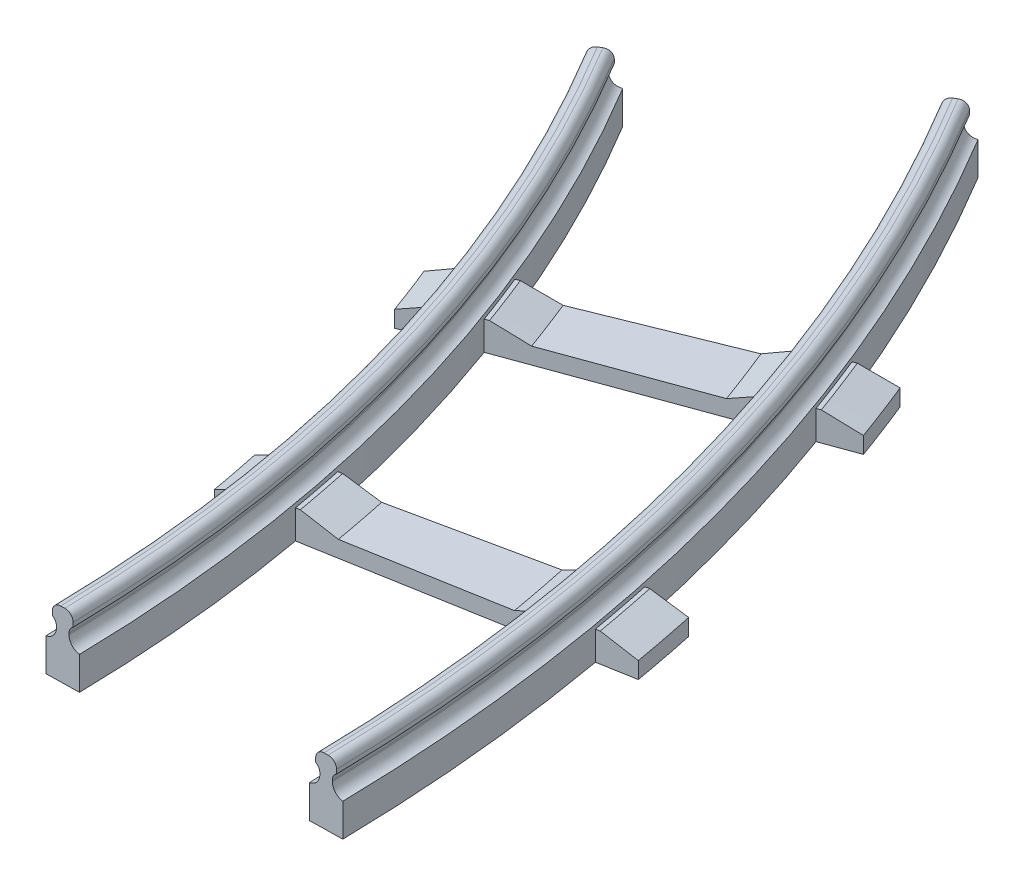
from build123d import *

# Parameters (mm, degrees)
SKETCH_1_W               = 4
SKETCH_1_H               = 21
SKETCH_1_H_2             = 8
EXTRUDE_1_DEPTH          = 4
SKETCH_1_7_W             = 44.5
SKETCH_1_7_H             = 8
EXTRUDE_2_DEPTH          = 3.5
SKETCH_2_W               = 18.5
SKETCH_2_H               = 1.5
CUT_EXTRUDE_1_DEPTH      = 37.7704025
SKETCH_2_3_W             = 2.5
SKETCH_2_3_H             = 1.5
EXTRUDE_4_DEPTH          = 29
FILLET_1_R               = 1
FILLET_2_R               = 1.5
FILLET_3_R               = 1
REVOLVE_2_ANGLE          = 32
CUT_EXTRUDE_5_DEPTH      = 125.273573818
REVOLVE_1_ANGLE          = 2
PATTERN_CIRCULAR_1_COUNT = 4
PATTERN_CIRCULAR_1_ANGLE = 30
CUT_REVOLVE_1_ANGLE      = 1
CUT_REVOLVE_2_ANGLE      = 1
CUT_REVOLVE_3_ANGLE      = 1
CUT_REVOLVE_4_ANGLE      = 1


with BuildPart() as part:
    # 草图1 → 凸台-拉伸1 (new body)
    with BuildSketch(Plane(origin=(0, 0, 0), x_dir=(1, 0, 0), z_dir=(0, 1, 0))):
        with Locations((-15.75, -4)):
            Rectangle(SKETCH_1_W, SKETCH_1_H)
        with Locations((15.75, -4)):
            Rectangle(SKETCH_1_W, SKETCH_1_H)
        with Locations((15.75, 10.5)):
            Rectangle(SKETCH_1_W, SKETCH_1_H_2)
        with Locations((-15.75, 10.5)):
            Rectangle(SKETCH_1_W, SKETCH_1_H_2)
    extrude(amount=EXTRUDE_1_DEPTH)

    # 草图1<7> → 凸台-拉伸2 (add)
    with BuildSketch(Plane(origin=(0, 0, 0), x_dir=(1, 0, 0), z_dir=(0, 1, 0))):
        with Locations((0, 10.5)):
            Rectangle(SKETCH_1_7_W, SKETCH_1_7_H)
    extrude(amount=EXTRUDE_2_DEPTH)

    # 草图2 → 切除-拉伸1 (cut, through all)
    with BuildSketch(Plane(origin=(0, 0, -14.5), x_dir=(-1, 0, 0), z_dir=(0, 0, -1))):
        with Locations((0, 2.75)):
            Rectangle(SKETCH_2_W, SKETCH_2_H)
        Polygon((13.25, 3.5), (9.25, 3.5), (9.25, 2), align=None)
        Polygon((-9.25, 3.5), (-13.25, 3.5), (-9.25, 2), align=None)
        Polygon((-22.25, 3.5), (-22.25, 2), (-18.25, 3.5), align=None)
        Polygon((22.25, 3.5), (18.25, 3.5), (22.25, 2), align=None)
    extrude(amount=-CUT_EXTRUDE_1_DEPTH, mode=Mode.SUBTRACT)

    # 草图2<3> → 凸台-拉伸4 (add, through all)
    with BuildSketch(Plane(origin=(0, 0, -14.5), x_dir=(-1, 0, 0), z_dir=(0, 0, -1))):
        with Locations((-15.75, 7.25)):
            Rectangle(SKETCH_2_3_W, SKETCH_2_3_H)
        Polygon((-15, 6.5), (-16.5, 6.5), (-16.5, 4), (-15.75, 4), (-15, 4), align=None)
        with Locations((15.75, 7.25)):
            Rectangle(SKETCH_2_3_W, SKETCH_2_3_H)
        Polygon((16.5, 6.5), (15, 6.5), (15, 4), (15.75, 4), (16.5, 4), align=None)
    extrude(amount=-EXTRUDE_4_DEPTH)

    # 圆角1
    # the kernel refuses this fillet: 1 mm, written as the material it adds along each edge
    with BuildSketch(Plane(origin=(-16.5, 6.5, -14.5), x_dir=(-1, 0, 0), z_dir=(0, 0, 1)), Plane(origin=(15, 6.5, -14.5), x_dir=(-1, 0, 0), z_dir=(0, 0, 1))) as fillet_1_piece_1:
        with BuildLine():
            CenterArc((1, 0.866025404), FILLET_1_R, 180, 60)
            Line((0, 0.866025404), (-0.02, 0.866025404))
            Line((-0.02, 0.866025404), (-0.02, 0))
            Line((-0.02, 0), (0, -0.02))
            ThreePointArc((0, -0.02), (0.25, -0.02), (0.49, -0.017320508))
            Line((0.49, -0.017320508), (0.5, 0))
        make_face()
    extrude(amount=29)
    with BuildSketch(Plane(origin=(-15, 6.5, -14.5), x_dir=(0, -1, 0), z_dir=(0, 0, 1)), Plane(origin=(16.5, 6.5, -14.5), x_dir=(0, -1, 0), z_dir=(0, 0, 1))) as fillet_1_piece_2:
        with BuildLine():
            CenterArc((0.866025404, 1), FILLET_1_R, 210, 60)
            Line((0, 0.5), (-0.017320508, 0.49))
            ThreePointArc((-0.017320508, 0.49), (-0.02, 0.25), (-0.02, 0))
            Line((-0.02, 0), (0, -0.02))
            Line((0, -0.02), (0.866025404, -0.02))
            Line((0.866025404, -0.02), (0.866025404, 0))
        make_face()
    extrude(amount=29)

    # 圆角2
    # the kernel refuses this fillet: 1.5 mm, written as the material it adds along each edge
    with BuildSketch(Plane(origin=(16.5, 4, -14.5), x_dir=(1, 0, 0), z_dir=(0, 0, 1))) as fillet_2_piece_1:
        with BuildLine():
            CenterArc((1.5, 1.479019946), FILLET_2_R, 180, 80.405931773)
            Line((0, 1.479019946), (-0.03, 1.479019946))
            Line((-0.03, 1.479019946), (-0.03, 0))
            Line((-0.03, 0), (0, -0.03))
            ThreePointArc((0, -0.03), (0.625, -0.03), (1.245, -0.029580399))
            Line((1.245, -0.029580399), (1.25, 0))
        make_face()
    extrude(amount=29)
    with BuildSketch(Plane(origin=(15, 4, -14.5), x_dir=(0, 1, 0), z_dir=(0, 0, 1)), Plane(origin=(-16.5, 4, -14.5), x_dir=(0, 1, 0), z_dir=(0, 0, 1))) as fillet_2_piece_2:
        with BuildLine():
            CenterArc((1.479019946, 1.5), FILLET_2_R, 189.594068227, 80.405931773)
            Line((0, 1.25), (-0.029580399, 1.245))
            ThreePointArc((-0.029580399, 1.245), (-0.03, 0.625), (-0.03, 0))
            Line((-0.03, 0), (0, -0.03))
            Line((0, -0.03), (1.479019946, -0.03))
            Line((1.479019946, -0.03), (1.479019946, 0))
        make_face()
    extrude(amount=29)
    with BuildSketch(Plane(origin=(-15, 4, -14.5), x_dir=(0, 1, 0), z_dir=(0, 0, 1))) as fillet_2_piece_3:
        with BuildLine():
            CenterArc((1.479019946, -1.5), FILLET_2_R, 90, 80.405931773)
            Line((0, -1.25), (-0.029580399, -1.245))
            ThreePointArc((-0.029580399, -1.245), (-0.03, -0.625), (-0.03, 0))
            Line((-0.03, 0), (0, 0.03))
            Line((0, 0.03), (1.479019946, 0.03))
            Line((1.479019946, 0.03), (1.479019946, 0))
        make_face()
    extrude(amount=29)

    # 圆角3
    fillet_3_edges = [part.edges().sort_by_distance(p)[0] for p in [
        (14.5, 8, 0),
        (17, 8, 0),
        (-17, 8, 0),
        (-14.5, 8, 0),
    ]]
    fillet(fillet_3_edges, radius=FILLET_3_R)

    # 草图7 → 旋转2 (revolve)
    with BuildSketch(Plane(origin=(0, 0, -14.5), x_dir=(-1, 0, 0), z_dir=(0, 0, -1))):
        with BuildLine():
            Line((-17.75, 3.5), (-17.75, 0))
            Line((-17.75, 0), (-13.75, 0))
            Line((-13.75, 0), (-13.75, 3.5))
            Line((-13.75, 3.5), (-13.75, 4))
            ThreePointArc((-13.75, 4), (-14.645643924, 4.510774109), (-15, 5.479019946))
            Line((-15, 5.479019946), (-15, 5.633974596))
            ThreePointArc((-15, 5.633974596), (-14.866025404, 6.133974596), (-14.5, 6.5))
            Line((-14.5, 6.5), (-14.5, 7))
            ThreePointArc((-14.5, 7), (-14.792893219, 7.707106781), (-15.5, 8))
            Line((-15.5, 8), (-16, 8))
            ThreePointArc((-16, 8), (-16.707106781, 7.707106781), (-17, 7))
            Line((-17, 7), (-17, 6.5))
            ThreePointArc((-17, 6.5), (-16.633974596, 6.133974596), (-16.5, 5.633974596))
            Line((-16.5, 5.633974596), (-16.5, 5.479019946))
            ThreePointArc((-16.5, 5.479019946), (-16.854356076, 4.510774109), (-17.75, 4))
            Line((-17.75, 4), (-17.75, 3.5))
        make_face()
        with BuildLine():
            Line((13.75, 3.5), (13.75, 0))
            Line((13.75, 0), (17.75, 0))
            Line((17.75, 0), (17.75, 3.5))
            Line((17.75, 3.5), (17.75, 4))
            ThreePointArc((17.75, 4), (16.854356076, 4.510774109), (16.5, 5.479019946))
            Line((16.5, 5.479019946), (16.5, 5.633974596))
            ThreePointArc((16.5, 5.633974596), (16.633974596, 6.133974596), (17, 6.5))
            Line((17, 6.5), (17, 7))
            ThreePointArc((17, 7), (16.707106781, 7.707106781), (16, 8))
            Line((16, 8), (15.5, 8))
            ThreePointArc((15.5, 8), (14.792893219, 7.707106781), (14.5, 7))
            Line((14.5, 7), (14.5, 6.5))
            ThreePointArc((14.5, 6.5), (14.866025404, 6.133974596), (15, 5.633974596))
            Line((15, 5.633974596), (15, 5.479019946))
            ThreePointArc((15, 5.479019946), (14.645643924, 4.510774109), (13.75, 4))
            Line((13.75, 4), (13.75, 3.5))
        make_face()
    revolve(axis=Axis((-200, 10, -14.5), (0, 1, 0)), revolution_arc=REVOLVE_2_ANGLE)

    # 草图5<2> → 切除-拉伸5 (cut, through all)
    with BuildSketch(Plane(origin=(0, 0, -14.5), x_dir=(-1, 0, 0), z_dir=(0, 0, -1))):
        with BuildLine():
            Line((17, 6.5), (17, 7))
            ThreePointArc((17, 7), (16.707106781, 7.707106781), (16, 8))
            Line((16, 8), (15.5, 8))
            ThreePointArc((15.5, 8), (14.792893219, 7.707106781), (14.5, 7))
            Line((14.5, 7), (14.5, 6.5))
            ThreePointArc((14.5, 6.5), (14.866025404, 6.133974596), (15, 5.633974596))
            Line((15, 5.633974596), (15, 5.479019946))
            ThreePointArc((15, 5.479019946), (14.645643924, 4.510774109), (13.75, 4))
            Line((13.75, 4), (13.75, 3.5))
            Line((13.75, 3.5), (13.25, 3.5))
            Line((13.25, 3.5), (9.25, 2))
            Line((9.25, 2), (-9.25, 2))
            Line((-9.25, 2), (-13.25, 3.5))
            Line((-13.25, 3.5), (-13.75, 3.5))
            Line((-13.75, 3.5), (-13.75, 4))
            ThreePointArc((-13.75, 4), (-14.645643924, 4.510774109), (-15, 5.479019946))
            Line((-15, 5.479019946), (-15, 5.633974596))
            ThreePointArc((-15, 5.633974596), (-14.866025404, 6.133974596), (-14.5, 6.5))
            Line((-14.5, 6.5), (-14.5, 7))
            ThreePointArc((-14.5, 7), (-14.792893219, 7.707106781), (-15.5, 8))
            Line((-15.5, 8), (-16, 8))
            ThreePointArc((-16, 8), (-16.707106781, 7.707106781), (-17, 7))
            Line((-17, 7), (-17, 6.5))
            ThreePointArc((-17, 6.5), (-16.633974596, 6.133974596), (-16.5, 5.633974596))
            Line((-16.5, 5.633974596), (-16.5, 5.479019946))
            ThreePointArc((-16.5, 5.479019946), (-16.854356076, 4.510774109), (-17.75, 4))
            Line((-17.75, 4), (-17.75, 3.5))
            Line((-17.75, 3.5), (-18.25, 3.5))
            Line((-18.25, 3.5), (-22.25, 2))
            Line((-22.25, 2), (-22.25, 0))
            Line((-22.25, 0), (22.25, 0))
            Line((22.25, 0), (22.25, 2))
            Line((22.25, 2), (18.25, 3.5))
            Line((18.25, 3.5), (17.75, 3.5))
            Line((17.75, 3.5), (17.75, 4))
            ThreePointArc((17.75, 4), (16.854356076, 4.510774109), (16.5, 5.479019946))
            Line((16.5, 5.479019946), (16.5, 5.633974596))
            ThreePointArc((16.5, 5.633974596), (16.633974596, 6.133974596), (17, 6.5))
        make_face()
    extrude(amount=-CUT_EXTRUDE_5_DEPTH, mode=Mode.SUBTRACT)


with BuildPart() as cut_extrude_5_piece_1:
    # of the separate pieces the step leaves, piece 1, a body of its own (cut_extrude_5_pieces)
    add(part.part.solids().sort_by_distance((13.75, 0, -14.5))[0])



with BuildPart() as cut_extrude_5_piece_2:
    # of the separate pieces the step leaves, piece 2, a body of its own (cut_extrude_5_pieces)
    add(part.part.solids().sort_by_distance((-13.75, 4, -14.5))[0])


with BuildPart() as cut_extrude_5_piece_1_1:
    add(cut_extrude_5_piece_1.part)

    add(cut_extrude_5_piece_2.part)  # 旋转1 merges 切除-拉伸5 piece 2
    # 草图5 → 旋转1 (revolve)
    with BuildSketch(Plane(origin=(0, 0, -14.5), x_dir=(-1, 0, 0), z_dir=(0, 0, -1))):
        with BuildLine():
            Line((17, 6.5), (17, 7))
            ThreePointArc((17, 7), (16.707106781, 7.707106781), (16, 8))
            Line((16, 8), (15.5, 8))
            ThreePointArc((15.5, 8), (14.792893219, 7.707106781), (14.5, 7))
            Line((14.5, 7), (14.5, 6.5))
            ThreePointArc((14.5, 6.5), (14.866025404, 6.133974596), (15, 5.633974596))
            Line((15, 5.633974596), (15, 5.479019946))
            ThreePointArc((15, 5.479019946), (14.645643924, 4.510774109), (13.75, 4))
            Line((13.75, 4), (13.75, 3.5))
            Line((13.75, 3.5), (13.25, 3.5))
            Line((13.25, 3.5), (9.25, 2))
            Line((9.25, 2), (-9.25, 2))
            Line((-9.25, 2), (-13.25, 3.5))
            Line((-13.25, 3.5), (-13.75, 3.5))
            Line((-13.75, 3.5), (-13.75, 4))
            ThreePointArc((-13.75, 4), (-14.645643924, 4.510774109), (-15, 5.479019946))
            Line((-15, 5.479019946), (-15, 5.633974596))
            ThreePointArc((-15, 5.633974596), (-14.866025404, 6.133974596), (-14.5, 6.5))
            Line((-14.5, 6.5), (-14.5, 7))
            ThreePointArc((-14.5, 7), (-14.792893219, 7.707106781), (-15.5, 8))
            Line((-15.5, 8), (-16, 8))
            ThreePointArc((-16, 8), (-16.707106781, 7.707106781), (-17, 7))
            Line((-17, 7), (-17, 6.5))
            ThreePointArc((-17, 6.5), (-16.633974596, 6.133974596), (-16.5, 5.633974596))
            Line((-16.5, 5.633974596), (-16.5, 5.479019946))
            ThreePointArc((-16.5, 5.479019946), (-16.854356076, 4.510774109), (-17.75, 4))
            Line((-17.75, 4), (-17.75, 3.5))
            Line((-17.75, 3.5), (-18.25, 3.5))
            Line((-18.25, 3.5), (-22.25, 2))
            Line((-22.25, 2), (-22.25, 0))
            Line((-22.25, 0), (22.25, 0))
            Line((22.25, 0), (22.25, 2))
            Line((22.25, 2), (18.25, 3.5))
            Line((18.25, 3.5), (17.75, 3.5))
            Line((17.75, 3.5), (17.75, 4))
            ThreePointArc((17.75, 4), (16.854356076, 4.510774109), (16.5, 5.479019946))
            Line((16.5, 5.479019946), (16.5, 5.633974596))
            ThreePointArc((16.5, 5.633974596), (16.633974596, 6.133974596), (17, 6.5))
        make_face()
    revolve_1 = revolve(axis=Axis((-200, 10, -14.5), (0, 1, 0)), revolution_arc=REVOLVE_1_ANGLE)

    # 阵列(圆周)1: 旋转1 ×4 about axis
    pattern_circular_1_axis = Axis((-200, 0, -14.5), (0, 1, 0))
    for i in range(1, PATTERN_CIRCULAR_1_COUNT):
        add(revolve_1.rotate(pattern_circular_1_axis, i * PATTERN_CIRCULAR_1_ANGLE / (PATTERN_CIRCULAR_1_COUNT - 1)))

    # 草图8 → 切除-旋转1 (revolve, cut)
    with BuildSketch(Plane.XY.offset(-14.5)):
        with BuildLine():
            Line((-22.25, 2), (-22.25, 0))
            Line((-22.25, 0), (22.25, 0))
            Line((22.25, 0), (22.25, 2))
            Line((22.25, 2), (18.25, 3.5))
            Line((18.25, 3.5), (17.75, 3.5))
            Line((17.75, 3.5), (17.75, 4))
            ThreePointArc((17.75, 4), (16.854356076, 4.510774109), (16.5, 5.479019946))
            Line((16.5, 5.479019946), (16.5, 5.633974596))
            ThreePointArc((16.5, 5.633974596), (16.633974596, 6.133974596), (17, 6.5))
            Line((17, 6.5), (17, 7))
            ThreePointArc((17, 7), (16.707106781, 7.707106781), (16, 8))
            Line((16, 8), (15.5, 8))
            ThreePointArc((15.5, 8), (14.792893219, 7.707106781), (14.5, 7))
            Line((14.5, 7), (14.5, 6.5))
            ThreePointArc((14.5, 6.5), (14.866025404, 6.133974596), (15, 5.633974596))
            Line((15, 5.633974596), (15, 5.479019946))
            ThreePointArc((15, 5.479019946), (14.645643924, 4.510774109), (13.75, 4))
            Line((13.75, 4), (13.75, 3.5))
            Line((13.75, 3.5), (13.25, 3.5))
            Line((13.25, 3.5), (9.25, 2))
            Line((9.25, 2), (-9.25, 2))
            Line((-9.25, 2), (-13.25, 3.5))
            Line((-13.25, 3.5), (-13.75, 3.5))
            Line((-13.75, 3.5), (-13.75, 4))
            ThreePointArc((-13.75, 4), (-14.645643924, 4.510774109), (-15, 5.479019946))
            Line((-15, 5.479019946), (-15, 5.633974596))
            ThreePointArc((-15, 5.633974596), (-14.866025404, 6.133974596), (-14.5, 6.5))
            Line((-14.5, 6.5), (-14.5, 7))
            ThreePointArc((-14.5, 7), (-14.792893219, 7.707106781), (-15.5, 8))
            Line((-15.5, 8), (-16, 8))
            ThreePointArc((-16, 8), (-16.707106781, 7.707106781), (-17, 7))
            Line((-17, 7), (-17, 6.5))
            ThreePointArc((-17, 6.5), (-16.633974596, 6.133974596), (-16.5, 5.633974596))
            Line((-16.5, 5.633974596), (-16.5, 5.479019946))
            ThreePointArc((-16.5, 5.479019946), (-16.854356076, 4.510774109), (-17.75, 4))
            Line((-17.75, 4), (-17.75, 3.5))
            Line((-17.75, 3.5), (-18.25, 3.5))
            Line((-18.25, 3.5), (-22.25, 2))
        make_face()
    revolve(axis=Axis((-200, 10, -14.5), (0, 1, 0)), revolution_arc=CUT_REVOLVE_1_ANGLE, mode=Mode.SUBTRACT)

    # 草图9 → 切除-旋转2 (revolve, cut)
    with BuildSketch(Plane(origin=(-62.679142157, 0, -100.307595444), x_dir=(-0.8480480961564253, 0, 0.529919264233206), z_dir=(-0.529919264233206, 0, -0.8480480961564253))):
        with BuildLine():
            Line((-15.8242101, 0), (-15.8242101, 2))
            Line((-15.8242101, 2), (-19.8242101, 3.5))
            Line((-19.8242101, 3.5), (-20.3242101, 3.5))
            Line((-20.3242101, 3.5), (-20.3242101, 4))
            ThreePointArc((-20.3242101, 4), (-21.219854024, 4.510774109), (-21.5742101, 5.479019946))
            Line((-21.5742101, 5.479019946), (-21.5742101, 5.633974596))
            ThreePointArc((-21.5742101, 5.633974596), (-21.440235504, 6.133974596), (-21.0742101, 6.5))
            Line((-21.0742101, 6.5), (-21.0742101, 7))
            ThreePointArc((-21.0742101, 7), (-21.367103319, 7.707106781), (-22.0742101, 8))
            Line((-22.0742101, 8), (-22.5742101, 8))
            ThreePointArc((-22.5742101, 8), (-23.281316881, 7.707106781), (-23.5742101, 7))
            Line((-23.5742101, 7), (-23.5742101, 6.5))
            ThreePointArc((-23.5742101, 6.5), (-23.208184696, 6.133974596), (-23.0742101, 5.633974596))
            Line((-23.0742101, 5.633974596), (-23.0742101, 5.479019946))
            ThreePointArc((-23.0742101, 5.479019946), (-23.428566176, 4.510774109), (-24.3242101, 4))
            Line((-24.3242101, 4), (-24.3242101, 3.5))
            Line((-24.3242101, 3.5), (-24.8242101, 3.5))
            Line((-24.8242101, 3.5), (-28.8242101, 2))
            Line((-28.8242101, 2), (-47.3242101, 2))
            Line((-47.3242101, 2), (-51.3242101, 3.5))
            Line((-51.3242101, 3.5), (-51.8242101, 3.5))
            Line((-51.8242101, 3.5), (-51.8242101, 4))
            ThreePointArc((-51.8242101, 4), (-52.719854024, 4.510774109), (-53.0742101, 5.479019946))
            Line((-53.0742101, 5.479019946), (-53.0742101, 5.633974596))
            ThreePointArc((-53.0742101, 5.633974596), (-52.940235504, 6.133974596), (-52.5742101, 6.5))
            Line((-52.5742101, 6.5), (-52.5742101, 7))
            ThreePointArc((-52.5742101, 7), (-52.867103319, 7.707106781), (-53.5742101, 8))
            Line((-53.5742101, 8), (-54.0742101, 8))
            ThreePointArc((-54.0742101, 8), (-54.781316881, 7.707106781), (-55.0742101, 7))
            Line((-55.0742101, 7), (-55.0742101, 6.5))
            ThreePointArc((-55.0742101, 6.5), (-54.708184696, 6.133974596), (-54.5742101, 5.633974596))
            Line((-54.5742101, 5.633974596), (-54.5742101, 5.479019946))
            ThreePointArc((-54.5742101, 5.479019946), (-54.928566176, 4.510774109), (-55.8242101, 4))
            Line((-55.8242101, 4), (-55.8242101, 3.5))
            Line((-55.8242101, 3.5), (-56.3242101, 3.5))
            Line((-56.3242101, 3.5), (-60.3242101, 2))
            Line((-60.3242101, 2), (-60.3242101, 0))
            Line((-60.3242101, 0), (-15.8242101, 0))
        make_face()
    revolve(axis=Axis((-200, 10, -14.5), (0, -1, 0)), revolution_arc=CUT_REVOLVE_2_ANGLE, mode=Mode.SUBTRACT)

    # 草图10 → 切除-旋转3 (revolve, cut)
    with BuildSketch(Plane(origin=(-0.313938649, 0, -17.985533166), x_dir=(0.9998476951563913, 0, -0.01745240643728355), z_dir=(0.01745240643728355, 0, 0.9998476951563913))):
        Polygon((-17.466479138, 3.5), (-17.466479138, 0), (-21.966479138, 0), (-21.966479138, 2), (-17.966479138, 3.5), align=None)
        Polygon((-13.466479138, 3.5), (-13.466479138, 0), (14.033520862, 0), (14.033520862, 3.5), (13.533520862, 3.5), (9.533520862, 2), (-8.966479138, 2), (-12.966479138, 3.5), align=None)
        Polygon((18.033520862, 3.5), (18.033520862, 0), (22.533520862, 0), (22.533520862, 2), (18.533520862, 3.5), align=None)
    revolve(axis=Axis((-200, 10, -14.5), (0, 1, 0)), revolution_arc=CUT_REVOLVE_3_ANGLE, mode=Mode.SUBTRACT)

    # 草图11 → 切除-旋转4 (revolve, cut)
    with BuildSketch(Plane(origin=(-59.45421377, 0, -98.948428116), x_dir=(-0.8571673007021117, 0, 0.5150380749100554), z_dir=(-0.5150380749100554, 0, -0.8571673007021118))):
        Polygon((-53.784591946, 3.5), (-53.784591946, 0), (-58.284591946, 0), (-58.284591946, 2), (-54.284591946, 3.5), align=None)
        Polygon((-49.784591946, 3.5), (-49.784591946, 0), (-22.284591946, 0), (-22.284591946, 3.5), (-22.784591946, 3.5), (-26.784591946, 2), (-45.284591946, 2), (-49.284591946, 3.5), align=None)
        Polygon((-18.284591946, 3.5), (-18.284591946, 0), (-13.784591946, 0), (-13.784591946, 2), (-17.784591946, 3.5), align=None)
    revolve(axis=Axis((-200, 10, -14.5), (0, -1, 0)), revolution_arc=CUT_REVOLVE_4_ANGLE, mode=Mode.SUBTRACT)


solid = cut_extrude_5_piece_1_1.part
